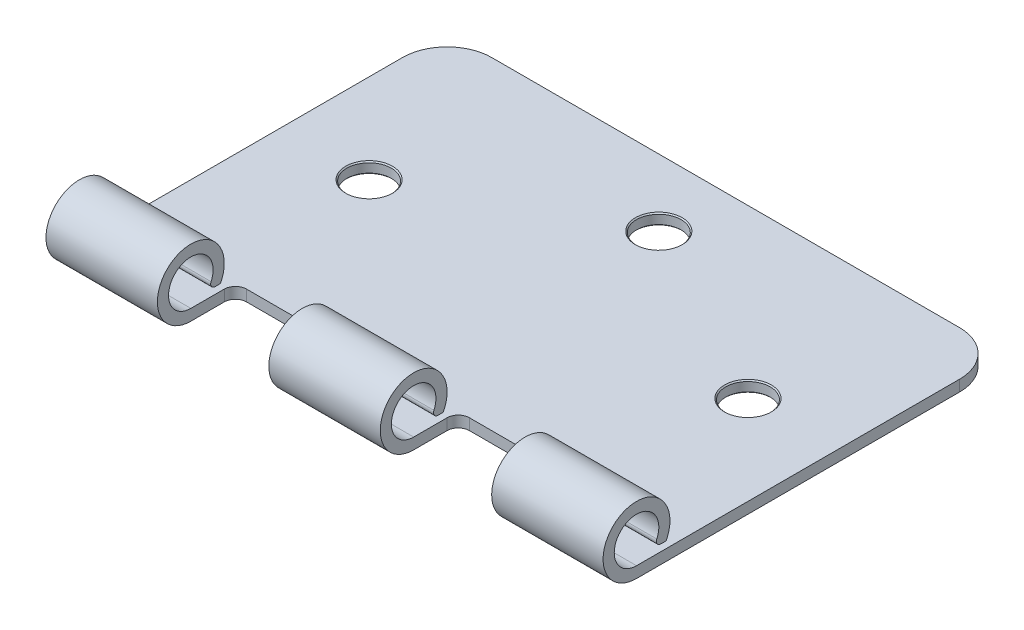
from build123d import *

# Parameters (mm, degrees)
SKETCH1_R           = 10
BOSS_EXTRUDE1_DEPTH = 5
BOSS_EXTRUDE2_DEPTH = 125
SKETCH3_W           = 50
SKETCH3_H           = 35
CUT_EXTRUDE1_DEPTH  = 30
CHAMFER1_SIZE       = 0.5
FILLET2_R           = 5
WRAP1_OUTLINE_W     = 1.13974359
WRAP1_OUTLINE_H     = 12.7
WRAP1_DEPTH         = 5


# Read off the part's stored shape, not the designer's step: Wrap1
with BuildPart() as part:
    # Sketch1 → Boss-Extrude1 (new body)
    with BuildSketch(Plane(origin=(0, 0, 0), x_dir=(1, 0, 0), z_dir=(0, 1, 0))):
        with BuildLine():
            Line((-105, 150), (105, 150))
            ThreePointArc((105, 150), (119.142135624, 144.142135624), (125, 130))
            Line((125, 130), (125, 0))
            Line((125, 0), (-125, 0))
            Line((-125, 0), (-125, 130))
            ThreePointArc((-125, 130), (-119.142135624, 144.142135624), (-105, 150))
        make_face()
        with Locations(Location((-85, 75, 0), (0, 0, 270))):
            Circle(SKETCH1_R, mode=Mode.SUBTRACT)
        with Locations(Location((85, 75, 0), (0, 0, 270))):
            Circle(SKETCH1_R, mode=Mode.SUBTRACT)
        with Locations(Location((0, 120, 0), (0, 0, 270))):
            Circle(SKETCH1_R, mode=Mode.SUBTRACT)
    extrude(amount=BOSS_EXTRUDE1_DEPTH)

    # Sketch2 → Boss-Extrude2 (add, symmetric)
    with BuildSketch(Plane(origin=(0, 0, 0), x_dir=(0, 0, -1), z_dir=(1, 0, 0))):
        with BuildLine():
            Line((0, 0), (-15, 0))
            ThreePointArc((-15, 0), (-22.745966692, 27.845232579), (-1.733500839, 8))
            Line((-1.733500839, 8), (-4.091287885, 8))
            ThreePointArc((-4.091287885, 8), (-5.774538708, 8.91987655), (-5.909406571, 10.833333333))
            ThreePointArc((-5.909406571, 10.833333333), (-20.400617249, 23.416254115), (-15, 5))
            Line((-15, 5), (0, 5))
            Line((0, 5), (0, 0))
        make_face()
    extrude(amount=BOSS_EXTRUDE2_DEPTH, both=True)

    # Sketch3 → Cut-Extrude1 (cut, symmetric)
    with BuildSketch(Plane(origin=(0, 0, 0), x_dir=(1, 0, 0), z_dir=(0, 1, 0))):
        with Locations((-50, -12.5)):
            Rectangle(SKETCH3_W, SKETCH3_H)
        with Locations((50, -12.5)):
            Rectangle(SKETCH3_W, SKETCH3_H)
    extrude(amount=CUT_EXTRUDE1_DEPTH, both=True, mode=Mode.SUBTRACT)

    # Chamfer1
    chamfer1_edges = [part.edges().sort_by_distance(p)[0] for p in [
        (-85, 0, -85),
        (-85, 5, -85),
        (85, 0, -85),
        (85, 5, -85),
        (0, 0, -130),
        (0, 5, -130),
    ]]
    chamfer(chamfer1_edges, length=CHAMFER1_SIZE)

    # Fillet2
    fillet2_edges = [part.edges().sort_by_distance(p)[0] for p in [
        (-25, 2.5, -5),
        (-75, 2.5, -5),
        (75, 2.5, -5),
        (25, 2.5, -5),
    ]]
    fillet(fillet2_edges, radius=FILLET2_R)

    # Wrap1 outline → Wrap1 (add)
    # profile 1 of 17: a face of its own
    with BuildSketch(Plane.XZ):
        with BuildLine():
            add(Edge.make_bspline(
                [(-60.70987489, -35.845821008), (-60.610023001, -36.012968919), (-60.418710634, -36.333217866), (-60.099572845, -36.765954184), (-59.768890568, -37.13375401), (-59.424214986, -37.4344777), (-59.067649974, -37.671237947), (-58.696867836, -37.838886045), (-58.313118066, -37.94344687), (-58.051955914, -37.956147184), (-57.921573608, -37.962487674)],
                knots=[0, 0, 0, 0, 0.159004299, 0.3046461, 0.438546905, 0.562322299, 0.677432543, 0.786897393, 0.893610889, 1, 1, 1, 1], degree=3))
            Line((-60.70987489, -35.845821008), (-61.783472647, -36.489470848))
            add(Edge.make_bspline(
                [(-57.921573608, -39.265051777), (-58.017496139, -39.263196918), (-58.208133154, -39.25951056), (-58.490107559, -39.226921343), (-58.766385497, -39.18081271), (-59.033500178, -39.107609656), (-59.294893072, -39.018793196), (-59.549427323, -38.909434104), (-59.797226289, -38.778380258), (-60.039678662, -38.628538312), (-60.276167809, -38.454157353), (-60.504475593, -38.251053523), (-60.732092923, -38.024828405), (-60.952301476, -37.769338646), (-61.169555456, -37.488711889), (-61.3795714, -37.180322566), (-61.586696489, -36.845850454), (-61.716655473, -36.610482857), (-61.783472647, -36.489470848)],
                knots=[0, 0, 0, 0, 0.057208269, 0.11369606, 0.169177916, 0.224159217, 0.278719878, 0.333794217, 0.389241459, 0.445822073, 0.503704281, 0.564293892, 0.627975416, 0.69503826, 0.765372726, 0.839611443, 0.91753775, 1, 1, 1, 1], degree=3))
            add(Edge.make_bspline(
                [(-54.293729057, -35.828012514), (-54.29611353, -35.941871153), (-54.30083617, -36.167377374), (-54.355122914, -36.498502938), (-54.434659985, -36.82010638), (-54.554537948, -37.128212416), (-54.700853408, -37.428457698), (-54.886513793, -37.712966365), (-55.101715964, -37.988035297), (-55.348581339, -38.24632968), (-55.618713613, -38.48344302), (-55.90422302, -38.694368471), (-56.205576867, -38.870239245), (-56.521140359, -39.0137523), (-56.850985981, -39.125996778), (-57.195002797, -39.207323475), (-57.55375788, -39.257237054), (-57.797599628, -39.262417789), (-57.921573608, -39.265051777)],
                knots=[0, 0, 0, 0, 0.061484255, 0.121774528, 0.18091956, 0.240256115, 0.300114444, 0.361145948, 0.423500582, 0.488669361, 0.553954105, 0.617581261, 0.680238427, 0.742187389, 0.804663212, 0.868258989, 0.933020257, 1, 1, 1, 1], degree=3))
            add(Edge.make_bspline(
                [(-57.28555598, -31.729514918), (-57.147721381, -31.829813566), (-56.880823782, -32.024027995), (-56.501066277, -32.315822034), (-56.156737317, -32.60120108), (-55.846627978, -32.878342683), (-55.567674624, -33.145144621), (-55.322972038, -33.404816732), (-55.110026855, -33.655498667), (-54.880776548, -33.976890585), (-54.646523889, -34.371610519), (-54.445350419, -34.855220128), (-54.318501558, -35.340709633), (-54.301913488, -35.667015583), (-54.293729057, -35.828012514)],
                knots=[0, 0, 0, 0, 0.09697231, 0.187773439, 0.272396139, 0.351320997, 0.424334774, 0.491908784, 0.55423322, 0.611267658, 0.716347845, 0.814540086, 0.908495456, 1, 1, 1, 1], degree=3))
            add(Edge.make_bspline(
                [(-58.992627294, -30.465111873), (-58.964827457, -30.48992051), (-58.898781408, -30.548860151), (-58.778037335, -30.645352141), (-58.618587752, -30.764379343), (-58.424596337, -30.91165332), (-58.192486196, -31.082491769), (-57.922231806, -31.274710304), (-57.616845673, -31.49454897), (-57.400140435, -31.648246331), (-57.28555598, -31.729514918)],
                knots=[0, 0, 0, 0, 0.052594282, 0.124951974, 0.218093899, 0.333502411, 0.468789179, 0.624937586, 0.801683048, 1, 1, 1, 1], degree=3))
            add(Edge.make_bspline(
                [(-59.829626493, -28.824186392), (-59.828200005, -28.892227472), (-59.825344696, -29.028420891), (-59.785521859, -29.229630336), (-59.734361437, -29.430331482), (-59.653289601, -29.629621997), (-59.541365214, -29.830987243), (-59.39438929, -30.03789469), (-59.209283843, -30.252168033), (-59.067490113, -30.391531932), (-58.992627294, -30.465111873)],
                knots=[0, 0, 0, 0, 0.107285214, 0.214745861, 0.32293856, 0.434116163, 0.553412311, 0.686072985, 0.834255992, 1, 1, 1, 1], degree=3))
            add(Edge.make_bspline(
                [(-57.967366878, -27.216333828), (-58.098563402, -27.220730568), (-58.35156354, -27.229209267), (-58.710756682, -27.321810356), (-59.034040353, -27.467613106), (-59.311816803, -27.671956027), (-59.543090977, -27.914057915), (-59.710387928, -28.192655475), (-59.811081382, -28.500294478), (-59.823368739, -28.714894203), (-59.829626493, -28.824186392)],
                knots=[0, 0, 0, 0, 0.143073084, 0.275902964, 0.402370856, 0.528413645, 0.650356379, 0.765895086, 0.880774131, 1, 1, 1, 1], degree=3))
            add(Edge.make_bspline(
                [(-55.486898128, -28.844538956), (-55.549113368, -28.764388566), (-55.668925375, -28.610037652), (-55.850823799, -28.393878879), (-56.022268893, -28.196424796), (-56.191180344, -28.024919903), (-56.348637235, -27.869972162), (-56.501461931, -27.737312473), (-56.647455149, -27.625641026), (-56.831485081, -27.506465823), (-57.062689374, -27.388332224), (-57.352918977, -27.288368427), (-57.656217746, -27.228297202), (-57.86279098, -27.220354667), (-57.967366878, -27.216333828)],
                knots=[0, 0, 0, 0, 0.098469431, 0.189629101, 0.274184089, 0.352183161, 0.423198873, 0.488550946, 0.548473346, 0.601440164, 0.701198082, 0.799591802, 0.898545098, 1, 1, 1, 1], degree=3))
            Line((-55.486898128, -28.844538956), (-54.45654957, -28.063509309))
            add(Edge.make_bspline(
                [(-57.840163352, -25.913769726), (-57.690506188, -25.918931556), (-57.392885855, -25.929196788), (-56.955101558, -26.018450688), (-56.533604101, -26.166135982), (-56.194538541, -26.333734827), (-55.929171092, -26.501125964), (-55.726795747, -26.653597898), (-55.52171814, -26.829130435), (-55.312284056, -27.028191128), (-55.102042234, -27.252606482), (-54.887871422, -27.500839553), (-54.669270789, -27.771373341), (-54.528642383, -27.964502244), (-54.45654957, -28.063509309)],
                knots=[0, 0, 0, 0, 0.107232799, 0.213251813, 0.318830447, 0.426793531, 0.483645951, 0.543603822, 0.60830765, 0.67712676, 0.750685636, 0.828713418, 0.912190348, 1, 1, 1, 1], degree=3))
            add(Edge.make_bspline(
                [(-60.969370083, -28.877611873), (-60.964634039, -28.743246691), (-60.95526318, -28.477388288), (-60.876013303, -28.089019275), (-60.750925946, -27.718228561), (-60.575684496, -27.368687065), (-60.349779244, -27.04949622), (-60.08835528, -26.756984424), (-59.776982173, -26.511081283), (-59.435342654, -26.2962261), (-59.061395247, -26.128056599), (-58.66954254, -26.001198186), (-58.259161736, -25.929318879), (-57.98120179, -25.919003704), (-57.840163352, -25.913769726)],
                knots=[0, 0, 0, 0, 0.083785371, 0.165779888, 0.246280008, 0.327460928, 0.408796954, 0.489715241, 0.571376032, 0.655523321, 0.741019483, 0.826546761, 0.911988852, 1, 1, 1, 1], degree=3))
            add(Edge.make_bspline(
                [(-60.25957441, -30.811105463), (-60.315717645, -30.736353129), (-60.426130853, -30.589342633), (-60.571876073, -30.359563863), (-60.695752463, -30.124348014), (-60.792861497, -29.88306302), (-60.874635777, -29.639096278), (-60.929637411, -29.389264615), (-60.964077623, -29.134689057), (-60.967604545, -28.963371497), (-60.969370083, -28.877611873)],
                knots=[0, 0, 0, 0, 0.133506769, 0.262558979, 0.388264447, 0.512667355, 0.63372227, 0.75539386, 0.877552945, 1, 1, 1, 1], degree=3))
            add(Edge.make_bspline(
                [(-58.17852473, -32.538529341), (-58.312143231, -32.443357037), (-58.567611629, -32.26139484), (-58.924875627, -31.99134101), (-59.24435125, -31.744438969), (-59.524618539, -31.51836441), (-59.765554219, -31.313086673), (-59.969056882, -31.130577008), (-60.129942503, -30.965899516), (-60.219407039, -30.859069505), (-60.25957441, -30.811105463)],
                knots=[0, 0, 0, 0, 0.181535301, 0.347081672, 0.495567816, 0.628357302, 0.74551967, 0.845830751, 0.930781807, 1, 1, 1, 1], degree=3))
            add(Edge.make_bspline(
                [(-55.888861269, -34.563609469), (-55.945723212, -34.490868138), (-56.065097748, -34.338156812), (-56.270320722, -34.1108441), (-56.511134908, -33.876371551), (-56.779299236, -33.62578583), (-57.084582159, -33.37074154), (-57.417421997, -33.099076645), (-57.786316571, -32.821122351), (-58.045031887, -32.634713328), (-58.17852473, -32.538529341)],
                knots=[0, 0, 0, 0, 0.090279215, 0.189529918, 0.299197872, 0.418925887, 0.548376285, 0.68813637, 0.839083502, 1, 1, 1, 1], degree=3))
            add(Edge.make_bspline(
                [(-55.433472647, -35.810204021), (-55.438822289, -35.704464366), (-55.449697328, -35.4895111), (-55.541614413, -35.172375216), (-55.686210252, -34.858530748), (-55.81960613, -34.664397584), (-55.888861269, -34.563609469)],
                knots=[0, 0, 0, 0, 0.234723374, 0.477158319, 0.728556284, 1, 1, 1, 1], degree=3))
            add(Edge.make_bspline(
                [(-57.921573608, -37.962487674), (-57.810224143, -37.959386434), (-57.589473567, -37.953238218), (-57.264490571, -37.894162165), (-56.948870888, -37.803403869), (-56.649119546, -37.67342506), (-56.369372601, -37.516168269), (-56.124056878, -37.326226425), (-55.911980982, -37.113569621), (-55.738502195, -36.876323989), (-55.605406067, -36.621173192), (-55.503109133, -36.359277597), (-55.446339866, -36.086523078), (-55.437788217, -35.902879399), (-55.433472647, -35.810204021)],
                knots=[0, 0, 0, 0, 0.091263605, 0.180930311, 0.27008822, 0.360156133, 0.448342532, 0.532665842, 0.613833704, 0.693981527, 0.772715977, 0.849335172, 0.923967327, 1, 1, 1, 1], degree=3))
        make_face()
    # profile 2 of 17: a face of its own
    with BuildSketch(Plane.XZ):
        with BuildLine():
            add(Edge.make_bspline(
                [(-37.075459826, -26.239410751), (-36.852415212, -26.241016648), (-36.421494178, -26.244119233), (-35.798786154, -26.263791138), (-35.22262793, -26.298590828), (-34.694914413, -26.349280251), (-34.214196873, -26.411521259), (-33.781821352, -26.489537012), (-33.395552147, -26.581659802), (-33.157991606, -26.660201864), (-33.045652134, -26.697343444)],
                knots=[0, 0, 0, 0, 0.164289216, 0.317405911, 0.458843612, 0.589366542, 0.707831319, 0.815770031, 0.912879903, 1, 1, 1, 1], degree=3))
            Line((-37.075459826, -26.239410751), (-39.639882903, -26.239410751))
            Line((-39.639882903, -26.239410751), (-39.639882903, -38.939410751))
            Line((-39.639882903, -38.939410751), (-35.70420582, -38.939410751))
            add(Edge.make_bspline(
                [(-29.219370083, -32.749687194), (-29.221652336, -32.906663688), (-29.226149755, -33.216002265), (-29.266533273, -33.671899229), (-29.325230205, -34.11427133), (-29.416104866, -34.541012013), (-29.526422558, -34.955860118), (-29.667806764, -35.354394262), (-29.82976985, -35.74027037), (-30.018636552, -36.108270926), (-30.225978149, -36.456916305), (-30.448488474, -36.785576079), (-30.685930198, -37.089560455), (-30.940567494, -37.36978999), (-31.20910978, -37.625842232), (-31.493315208, -37.859856116), (-31.793917135, -38.067252758), (-32.109569186, -38.256181979), (-32.449479712, -38.420992983), (-32.820086998, -38.560439019), (-33.222971558, -38.675996738), (-33.657144487, -38.772411131), (-34.123355964, -38.848891629), (-34.622063068, -38.900150253), (-35.152499577, -38.934813752), (-35.51673291, -38.937848665), (-35.70420582, -38.939410751)],
                knots=[0, 0, 0, 0, 0.046080683, 0.0908068, 0.134295271, 0.177024386, 0.218822734, 0.260244116, 0.301079867, 0.341613894, 0.381583419, 0.420119591, 0.458074619, 0.494738488, 0.531194623, 0.566933698, 0.602712651, 0.638326606, 0.674853249, 0.713467371, 0.754441804, 0.797815361, 0.843989456, 0.89307157, 0.944963346, 1, 1, 1, 1], degree=3))
            add(Edge.make_bspline(
                [(-33.045652134, -26.697343444), (-32.89871408, -26.753334861), (-32.608170039, -26.864047997), (-32.194487052, -27.072895148), (-31.805049306, -27.309525545), (-31.437768409, -27.574251104), (-31.101033982, -27.874567454), (-30.781691042, -28.197717451), (-30.49280333, -28.555452285), (-30.22825037, -28.940352956), (-29.989723835, -29.34788526), (-29.782390319, -29.777272654), (-29.610200115, -30.226334523), (-29.467258978, -30.69382206), (-29.354604689, -31.180763203), (-29.277744537, -31.687724945), (-29.227049802, -32.212703718), (-29.221955102, -32.568936772), (-29.219370083, -32.749687194)],
                knots=[0, 0, 0, 0, 0.061544966, 0.121694296, 0.181154855, 0.239875389, 0.298701942, 0.357647424, 0.417604843, 0.478494041, 0.540407051, 0.602344994, 0.665004328, 0.728559309, 0.793650542, 0.860534268, 0.929235961, 1, 1, 1, 1], degree=3))
        make_face()
        with BuildLine():
            add(Edge.make_bspline(
                [(-37.04238691, -37.636846649), (-36.832915393, -37.635946413), (-36.430024953, -37.634214931), (-35.850694506, -37.619021365), (-35.321360696, -37.594194906), (-34.841948362, -37.559451053), (-34.412728188, -37.513482078), (-34.032803152, -37.462228859), (-33.703418644, -37.398375252), (-33.504103258, -37.340496056), (-33.411998288, -37.313749694)],
                knots=[0, 0, 0, 0, 0.171900665, 0.330627932, 0.475548836, 0.60674619, 0.725023803, 0.829742387, 0.92132282, 1, 1, 1, 1], degree=3))
            Line((-37.04238691, -37.636846649), (-38.500139314, -37.636846649))
            Line((-38.500139314, -37.636846649), (-38.500139314, -27.541974854))
            Line((-38.500139314, -27.541974854), (-37.607170564, -27.541974854))
            add(Edge.make_bspline(
                [(-33.704566397, -27.898144726), (-33.811069128, -27.868693687), (-34.037523156, -27.8060727), (-34.407054925, -27.737763491), (-34.822944182, -27.67751288), (-35.287037383, -27.62650228), (-35.798805506, -27.589899714), (-36.358642145, -27.562426658), (-36.966789282, -27.543896877), (-37.388365904, -27.542631568), (-37.607170564, -27.541974854)],
                knots=[0, 0, 0, 0, 0.084318617, 0.179284514, 0.286582528, 0.405111483, 0.535592873, 0.67819021, 0.83297584, 1, 1, 1, 1], degree=3))
            add(Edge.make_bspline(
                [(-30.359113673, -32.747143123), (-30.360976172, -32.598613066), (-30.36463507, -32.306824454), (-30.410624711, -31.878686789), (-30.477831498, -31.466914142), (-30.575018016, -31.071478976), (-30.698864347, -30.691609813), (-30.853422047, -30.32940759), (-31.030012352, -29.981047066), (-31.240118745, -29.654568653), (-31.470226756, -29.345802228), (-31.725597918, -29.062937249), (-32.002175029, -28.805329359), (-32.296941483, -28.568966711), (-32.618204671, -28.363358515), (-32.958396635, -28.179438272), (-33.322508071, -28.023352038), (-33.575828424, -27.94033445), (-33.704566397, -27.898144726)],
                knots=[0, 0, 0, 0, 0.070151176, 0.137812606, 0.203226247, 0.267174055, 0.330024003, 0.391794272, 0.453084399, 0.514333908, 0.574999993, 0.634865483, 0.694116315, 0.753441622, 0.8131258, 0.874079686, 0.936007013, 1, 1, 1, 1], degree=3))
            add(Edge.make_bspline(
                [(-33.411998288, -37.313749694), (-33.296071374, -37.272922611), (-33.066986458, -37.192243599), (-32.737217949, -37.045077229), (-32.429671104, -36.870753147), (-32.138986155, -36.676979182), (-31.869286577, -36.456920831), (-31.617376212, -36.215363243), (-31.383762247, -35.95107706), (-31.170858329, -35.664390302), (-30.980328197, -35.357087329), (-30.815332594, -35.032189276), (-30.670728465, -34.693255993), (-30.557231857, -34.33508276), (-30.468275309, -33.960871605), (-30.405266298, -33.570596203), (-30.366024298, -33.164329437), (-30.361447044, -32.888006015), (-30.359113673, -32.747143123)],
                knots=[0, 0, 0, 0, 0.0624145, 0.123338231, 0.183124538, 0.241782995, 0.300578883, 0.359680075, 0.418881641, 0.479530664, 0.540850536, 0.602303396, 0.664463212, 0.727805723, 0.792894815, 0.859672328, 0.928464401, 1, 1, 1, 1], degree=3))
        make_face(mode=Mode.SUBTRACT)
    # profile 3 of 17: a face of its own
    with BuildSketch(Plane.XZ):
        with BuildLine():
            add(Edge.make_bspline(
                [(-19.727442999, -26.239410751), (-19.556134854, -26.239599061), (-19.22790084, -26.239959869), (-18.757220495, -26.25089909), (-18.329739469, -26.26551023), (-17.946379516, -26.285764528), (-17.605961102, -26.309700727), (-17.310024616, -26.343272413), (-17.05624394, -26.378325485), (-16.904183395, -26.41396316), (-16.834834826, -26.43021604)],
                knots=[0, 0, 0, 0, 0.176955752, 0.33905508, 0.486318225, 0.618780923, 0.735618828, 0.838742477, 0.926457068, 1, 1, 1, 1], degree=3))
            Line((-19.727442999, -26.239410751), (-22.218088032, -26.239410751))
            Line((-22.218088032, -26.239410751), (-22.218088032, -38.939410751))
            Line((-22.218088032, -38.939410751), (-21.078344442, -38.939410751))
            Line((-21.078344442, -38.939410751), (-21.078344442, -33.07787229))
            Line((-21.078344442, -33.07787229), (-20.170111269, -33.07787229))
            add(Edge.make_bspline(
                [(-16.936597647, -32.869258508), (-17.016162545, -32.886178468), (-17.190533644, -32.923259544), (-17.477708664, -32.964655944), (-17.812064779, -32.999989524), (-18.193145623, -33.026482223), (-18.620609135, -33.049162131), (-19.094686555, -33.067189215), (-19.616308492, -33.077094685), (-19.980149863, -33.077605561), (-20.170111269, -33.07787229)],
                knots=[0, 0, 0, 0, 0.075173117, 0.164746258, 0.268016881, 0.385911876, 0.517789479, 0.663690977, 0.824413221, 1, 1, 1, 1], degree=3))
            add(Edge.make_bspline(
                [(-14.402703416, -29.645921168), (-14.404232586, -29.750343387), (-14.40722451, -29.95465251), (-14.443133888, -30.253548056), (-14.49150344, -30.539183357), (-14.565878459, -30.810925077), (-14.663289901, -31.067159445), (-14.777561064, -31.311802201), (-14.915387017, -31.540691296), (-15.0737554, -31.754657694), (-15.249928328, -31.953902233), (-15.443160418, -32.136981059), (-15.652671565, -32.302822515), (-15.877795931, -32.451798391), (-16.120728239, -32.580454034), (-16.377784054, -32.695687683), (-16.651197696, -32.792465531), (-16.840400532, -32.843374611), (-16.936597647, -32.869258508)],
                knots=[0, 0, 0, 0, 0.070118894, 0.137192353, 0.202016181, 0.264631407, 0.326116547, 0.386010305, 0.445811847, 0.505297697, 0.564633278, 0.624282625, 0.683902032, 0.743952771, 0.805387731, 0.868388031, 0.933084028, 1, 1, 1, 1], degree=3))
            add(Edge.make_bspline(
                [(-16.834834826, -26.43021604), (-16.747046861, -26.454244258), (-16.573539544, -26.501734499), (-16.323527187, -26.596852867), (-16.085660376, -26.709636723), (-15.859123007, -26.838175019), (-15.646698877, -26.987982638), (-15.445218671, -27.152986908), (-15.256460457, -27.336997457), (-15.081485692, -27.537950427), (-14.920795141, -27.752472332), (-14.782438864, -27.983765566), (-14.66658864, -28.227936867), (-14.567226484, -28.484816396), (-14.495712949, -28.756561285), (-14.441839913, -29.041283355), (-14.407645607, -29.338952088), (-14.404370597, -29.542369322), (-14.402703416, -29.645921168)],
                knots=[0, 0, 0, 0, 0.062481339, 0.123490383, 0.183411094, 0.243153221, 0.302126735, 0.361709671, 0.421842292, 0.482931901, 0.544552254, 0.60568072, 0.667679738, 0.729984388, 0.794550921, 0.86034562, 0.928907356, 1, 1, 1, 1], degree=3))
        make_face()
        with BuildLine():
            add(Edge.make_bspline(
                [(-18.854826814, -31.803292963), (-18.746260226, -31.803349074), (-18.536674666, -31.803457394), (-18.23392037, -31.788996726), (-17.953035242, -31.772303365), (-17.694882068, -31.747861585), (-17.459344478, -31.713313023), (-17.24602973, -31.678436145), (-17.056591875, -31.627979544), (-16.834889057, -31.56004155), (-16.587843768, -31.444171773), (-16.319084377, -31.275987886), (-16.091316821, -31.061609316), (-15.894219001, -30.820571186), (-15.737806244, -30.552422916), (-15.623303072, -30.265515631), (-15.556025158, -29.96279172), (-15.547003827, -29.755643331), (-15.542447006, -29.651009309)],
                knots=[0, 0, 0, 0, 0.072538371, 0.140033831, 0.202495681, 0.260575056, 0.313228338, 0.361583194, 0.404878361, 0.444127437, 0.516399693, 0.586506671, 0.655085374, 0.724383783, 0.793973529, 0.861637682, 0.930110942, 1, 1, 1, 1], degree=3))
            Line((-18.854826814, -31.803292963), (-21.078344442, -31.775308187))
            Line((-21.078344442, -31.775308187), (-21.078344442, -27.541974854))
            Line((-21.078344442, -27.541974854), (-18.755608064, -27.541974854))
            add(Edge.make_bspline(
                [(-15.542447006, -29.651009309), (-15.547028609, -29.548906703), (-15.556136269, -29.345939359), (-15.623830401, -29.048473571), (-15.737583625, -28.764589729), (-15.895268982, -28.499801677), (-16.08664394, -28.259630874), (-16.309072985, -28.050998441), (-16.562032533, -27.883279691), (-16.797338971, -27.775027498), (-17.006348989, -27.70893207), (-17.187893529, -27.662686506), (-17.392873977, -27.625763592), (-17.621357062, -27.595865967), (-17.87157186, -27.570271979), (-18.145668031, -27.552905719), (-18.442607251, -27.542740435), (-18.648748465, -27.542236226), (-18.755608064, -27.541974854)],
                knots=[0, 0, 0, 0, 0.070043755, 0.139238317, 0.208197455, 0.279173374, 0.349986812, 0.418353846, 0.487609584, 0.557411073, 0.595330157, 0.637964052, 0.685912778, 0.738185165, 0.796102647, 0.858516544, 0.926657726, 1, 1, 1, 1], degree=3))
        make_face(mode=Mode.SUBTRACT)
    # profile 4 of 17: a face of its own
    with BuildSketch(Plane.XZ):
        with BuildLine():
            add(Edge.make_bspline(
                [(50.448198026, -26.239410751), (50.619506171, -26.239599061), (50.947740185, -26.239959869), (51.41842053, -26.25089909), (51.845901556, -26.26551023), (52.22926151, -26.285764528), (52.569679923, -26.309700727), (52.86561641, -26.343272413), (53.119397086, -26.378325485), (53.271457631, -26.41396316), (53.340806199, -26.43021604)],
                knots=[0, 0, 0, 0, 0.176955752, 0.33905508, 0.486318225, 0.618780923, 0.735618828, 0.838742477, 0.926457068, 1, 1, 1, 1], degree=3))
            Line((50.448198026, -26.239410751), (47.957552994, -26.239410751))
            Line((47.957552994, -26.239410751), (47.957552994, -38.939410751))
            Line((47.957552994, -38.939410751), (49.097296584, -38.939410751))
            Line((49.097296584, -38.939410751), (49.097296584, -33.07787229))
            Line((49.097296584, -33.07787229), (50.005529757, -33.07787229))
            add(Edge.make_bspline(
                [(53.239043379, -32.869258508), (53.159478481, -32.886178468), (52.985107382, -32.923259544), (52.697932361, -32.964655944), (52.363576247, -32.999989524), (51.982495402, -33.026482223), (51.55503189, -33.049162131), (51.080954471, -33.067189215), (50.559332534, -33.077094685), (50.195491162, -33.077605561), (50.005529757, -33.07787229)],
                knots=[0, 0, 0, 0, 0.075173117, 0.164746258, 0.268016881, 0.385911876, 0.517789479, 0.663690977, 0.824413221, 1, 1, 1, 1], degree=3))
            add(Edge.make_bspline(
                [(55.77293761, -29.645921168), (55.77140844, -29.750343387), (55.768416516, -29.95465251), (55.732507138, -30.253548056), (55.684137585, -30.539183357), (55.609762567, -30.810925077), (55.512351124, -31.067159445), (55.398079961, -31.311802201), (55.260254008, -31.540691296), (55.101885626, -31.754657694), (54.925712698, -31.953902233), (54.732480608, -32.136981059), (54.522969461, -32.302822515), (54.297845095, -32.451798391), (54.054912786, -32.580454034), (53.797856972, -32.695687683), (53.52444333, -32.792465531), (53.335240493, -32.843374611), (53.239043379, -32.869258508)],
                knots=[0, 0, 0, 0, 0.070118894, 0.137192353, 0.202016181, 0.264631407, 0.326116547, 0.386010305, 0.445811847, 0.505297697, 0.564633278, 0.624282625, 0.683902032, 0.743952771, 0.805387731, 0.868388031, 0.933084028, 1, 1, 1, 1], degree=3))
            add(Edge.make_bspline(
                [(53.340806199, -26.43021604), (53.428594165, -26.454244258), (53.602101482, -26.501734499), (53.852113838, -26.596852867), (54.089980649, -26.709636723), (54.316518018, -26.838175019), (54.528942148, -26.987982638), (54.730422354, -27.152986908), (54.919180568, -27.336997457), (55.094155333, -27.537950427), (55.254845884, -27.752472332), (55.393202162, -27.983765566), (55.509052386, -28.227936867), (55.608414542, -28.484816396), (55.679928077, -28.756561285), (55.733801113, -29.041283355), (55.767995419, -29.338952088), (55.771270429, -29.542369322), (55.77293761, -29.645921168)],
                knots=[0, 0, 0, 0, 0.062481339, 0.123490383, 0.183411094, 0.243153221, 0.302126735, 0.361709671, 0.421842292, 0.482931901, 0.544552254, 0.60568072, 0.667679738, 0.729984388, 0.794550921, 0.86034562, 0.928907356, 1, 1, 1, 1], degree=3))
        make_face()
        with BuildLine():
            add(Edge.make_bspline(
                [(51.320814212, -31.803292963), (51.4293808, -31.803349074), (51.63896636, -31.803457394), (51.941720656, -31.788996726), (52.222605784, -31.772303365), (52.480758957, -31.747861585), (52.716296548, -31.713313023), (52.929611296, -31.678436145), (53.119049151, -31.627979544), (53.340751969, -31.56004155), (53.587797258, -31.444171773), (53.856556648, -31.275987886), (54.084324205, -31.061609316), (54.281422024, -30.820571186), (54.437834781, -30.552422916), (54.552337953, -30.265515631), (54.619615867, -29.96279172), (54.628637199, -29.755643331), (54.63319402, -29.651009309)],
                knots=[0, 0, 0, 0, 0.072538371, 0.140033831, 0.202495681, 0.260575056, 0.313228338, 0.361583194, 0.404878361, 0.444127437, 0.516399693, 0.586506671, 0.655085374, 0.724383783, 0.793973529, 0.861637682, 0.930110942, 1, 1, 1, 1], degree=3))
            Line((51.320814212, -31.803292963), (49.097296584, -31.775308187))
            Line((49.097296584, -31.775308187), (49.097296584, -27.541974854))
            Line((49.097296584, -27.541974854), (51.420032962, -27.541974854))
            add(Edge.make_bspline(
                [(54.63319402, -29.651009309), (54.628612417, -29.548906703), (54.619504757, -29.345939359), (54.551810625, -29.048473571), (54.4380574, -28.764589729), (54.280372043, -28.499801677), (54.088997086, -28.259630874), (53.866568041, -28.050998441), (53.613608493, -27.883279691), (53.378302054, -27.775027498), (53.169292036, -27.70893207), (52.987747496, -27.662686506), (52.782767049, -27.625763592), (52.554283963, -27.595865967), (52.304069166, -27.570271979), (52.029972995, -27.552905719), (51.733033775, -27.542740435), (51.526892561, -27.542236226), (51.420032962, -27.541974854)],
                knots=[0, 0, 0, 0, 0.070043755, 0.139238317, 0.208197455, 0.279173374, 0.349986812, 0.418353846, 0.487609584, 0.557411073, 0.595330157, 0.637964052, 0.685912778, 0.738185165, 0.796102647, 0.858516544, 0.926657726, 1, 1, 1, 1], degree=3))
        make_face(mode=Mode.SUBTRACT)
    # profile 5 of 17: a face of its own
    with BuildSketch(Plane.XZ):
        with BuildLine():
            add(Edge.make_bspline(
                [(81.434976872, -26.239410751), (81.604580396, -26.239975306), (81.930237948, -26.241059314), (82.396775244, -26.247103654), (82.82069071, -26.264427745), (83.201762698, -26.279336033), (83.539984218, -26.306521077), (83.836392387, -26.332503997), (84.089622032, -26.366516995), (84.242914121, -26.398105244), (84.312320622, -26.412407546)],
                knots=[0, 0, 0, 0, 0.176257755, 0.338434414, 0.484822051, 0.617157578, 0.734698361, 0.837385184, 0.926372421, 1, 1, 1, 1], degree=3))
            Line((81.434976872, -26.239410751), (78.89345043, -26.239410751))
            Line((78.89345043, -26.239410751), (78.89345043, -38.939410751))
            Line((78.89345043, -38.939410751), (80.03319402, -38.939410751))
            Line((80.03319402, -38.939410751), (80.03319402, -33.07787229))
            Line((80.03319402, -33.07787229), (80.959235686, -33.07787229))
            Line((80.959235686, -33.07787229), (85.625061007, -38.939410751))
            Line((85.625061007, -38.939410751), (87.034476071, -38.939410751))
            Line((87.034476071, -38.939410751), (82.368650751, -33.07787229))
            add(Edge.make_bspline(
                [(86.871655558, -29.635744886), (86.866325194, -29.804963694), (86.855924272, -30.135153418), (86.758950324, -30.614345759), (86.600104095, -31.061346986), (86.381216732, -31.475594272), (86.102471778, -31.8490129), (85.767464679, -32.177001123), (85.376008545, -32.451465949), (85.011593599, -32.641794697), (84.689687789, -32.763688966), (84.424681197, -32.849455182), (84.135603878, -32.915720028), (83.82522555, -32.975083934), (83.492254571, -33.01990294), (83.137489, -33.052729154), (82.760675821, -33.073245274), (82.501816912, -33.076300549), (82.368650751, -33.07787229)],
                knots=[0, 0, 0, 0, 0.078780236, 0.153720644, 0.22671353, 0.299191166, 0.371189997, 0.443006414, 0.516689173, 0.593217217, 0.633872918, 0.676989142, 0.722899506, 0.771958611, 0.824211323, 0.879378651, 0.937948119, 1, 1, 1, 1], degree=3))
            add(Edge.make_bspline(
                [(84.312320622, -26.412407546), (84.405236087, -26.435364666), (84.589084877, -26.480789169), (84.853789403, -26.57679972), (85.106027093, -26.687905215), (85.344750169, -26.818402143), (85.568762897, -26.969259201), (85.780375054, -27.137872102), (85.980546878, -27.323318249), (86.161183079, -27.530273245), (86.331504781, -27.747394295), (86.47515494, -27.982176498), (86.598985309, -28.227691184), (86.697575471, -28.486435242), (86.77696126, -28.755899386), (86.832936472, -29.038524448), (86.866505067, -29.333022844), (86.869922657, -29.53389297), (86.871655558, -29.635744886)],
                knots=[0, 0, 0, 0, 0.064216843, 0.127063766, 0.188744538, 0.249132103, 0.309452533, 0.369826676, 0.430650142, 0.492351932, 0.554072106, 0.615689784, 0.676797703, 0.738439048, 0.80131691, 0.865184512, 0.931641324, 1, 1, 1, 1], degree=3))
        make_face()
        with BuildLine():
            add(Edge.make_bspline(
                [(82.358474468, -31.793116681), (82.467041467, -31.793164711), (82.677475231, -31.793257807), (82.981914786, -31.778766105), (83.265379192, -31.76228035), (83.526784207, -31.737064153), (83.766246609, -31.704566407), (83.983646708, -31.663915579), (84.179339382, -31.616555237), (84.407571221, -31.543252195), (84.662429492, -31.427116072), (84.939403647, -31.258149833), (85.175269272, -31.045627601), (85.374542658, -30.802609632), (85.534669453, -30.535415243), (85.647561764, -30.247247275), (85.719198626, -29.945380619), (85.72764792, -29.737905771), (85.731911968, -29.633200815)],
                knots=[0, 0, 0, 0, 0.07166815, 0.138913286, 0.20118457, 0.259124428, 0.312255041, 0.36068151, 0.405086143, 0.445101659, 0.51877778, 0.589461579, 0.658462242, 0.727283218, 0.796322487, 0.863174893, 0.930949381, 1, 1, 1, 1], degree=3))
            Line((82.358474468, -31.793116681), (80.03319402, -31.775308187))
            Line((80.03319402, -31.775308187), (80.03319402, -27.541974854))
            Line((80.03319402, -27.541974854), (82.41444402, -27.541974854))
            add(Edge.make_bspline(
                [(85.731911968, -29.633200815), (85.727549986, -29.531068962), (85.718906129, -29.328680896), (85.648334883, -29.032386593), (85.528993414, -28.75274366), (85.368167008, -28.490889671), (85.172227217, -28.25319743), (84.942474011, -28.049826332), (84.685189445, -27.882006845), (84.444719669, -27.774766665), (84.229784098, -27.709017483), (84.043167903, -27.662748974), (83.832306255, -27.625576187), (83.596175305, -27.595792652), (83.335783102, -27.570193283), (83.049813025, -27.552951114), (82.740162422, -27.542740808), (82.525543558, -27.542236114), (82.41444402, -27.541974854)],
                knots=[0, 0, 0, 0, 0.068814296, 0.136364825, 0.204019354, 0.273063739, 0.34291332, 0.410965444, 0.479168767, 0.549308007, 0.587651576, 0.630646669, 0.678878786, 0.731934299, 0.791111423, 0.85528319, 0.925085939, 1, 1, 1, 1], degree=3))
        make_face(mode=Mode.SUBTRACT)
    # profile 6 of 17: a face of its own
    with BuildSketch(Plane.XZ):
        Polygon((-89.648676974, -34.868897931), (-87.771152935, -38.939410751), (-86.532190596, -38.939410751), (-92.393729057, -26.239410751), (-92.55654957, -26.239410751), (-98.580908544, -38.939410751), (-97.336858064, -38.939410751), (-95.405908544, -34.868897931), align=None)
        Polygon((-92.487859666, -28.71479136), (-90.249077615, -33.566333828), (-94.78769941, -33.566333828), align=None, mode=Mode.SUBTRACT)
    # profile 7 of 17: a face of its own
    with BuildSketch(Plane.XZ):
        Polygon((-83.112959826, -32.810744886), (-77.223436589, -38.939410751), (-75.704626493, -38.939410751), (-82.433692999, -31.9381287), (-76.193088032, -26.239410751), (-77.818749089, -26.239410751), (-83.112959826, -31.075688796), (-83.112959826, -26.239410751), (-84.252703416, -26.239410751), (-84.252703416, -38.939410751), (-83.112959826, -38.939410751), align=None)
    # profile 8 of 17: a face of its own
    with BuildSketch(Plane.XZ):
        Polygon((-65.876882102, -34.868897931), (-63.999358064, -38.939410751), (-62.760395724, -38.939410751), (-68.621934185, -26.239410751), (-68.784754698, -26.239410751), (-74.809113673, -38.939410751), (-73.565063192, -38.939410751), (-71.634113673, -34.868897931), align=None)
        Polygon((-68.716064794, -28.71479136), (-66.477282743, -33.566333828), (-71.015904538, -33.566333828), align=None, mode=Mode.SUBTRACT)
    # profile 9 of 17: a face of its own
    with BuildSketch(Plane.XZ):
        Polygon((-44.036036749, -32.752231264), (-44.036036749, -38.939410751), (-42.89629316, -38.939410751), (-42.89629316, -26.239410751), (-44.036036749, -26.239410751), (-44.036036749, -31.449667162), (-50.548857262, -31.449667162), (-50.548857262, -26.239410751), (-51.688600852, -26.239410751), (-51.688600852, -38.939410751), (-50.548857262, -38.939410751), (-50.548857262, -32.752231264), align=None)
    # profile 10 of 17: a face of its own
    with BuildSketch(Plane.XZ):
        with Locations((-26.044370083, -32.589410751)):
            Rectangle(WRAP1_OUTLINE_W, WRAP1_OUTLINE_H)
    # profile 11 of 17: a face of its own
    with BuildSketch(Plane.XZ):
        Polygon((4.240245302, -29.801109469), (5.456311007, -38.939410751), (6.601142738, -38.939410751), (4.914423988, -26.239410751), (4.749059404, -26.239410751), (-0.48154957, -36.659923572), (-5.724878897, -26.239410751), (-5.88769941, -26.239410751), (-7.564241878, -38.939410751), (-6.416866076, -38.939410751), (-5.203344442, -29.780756905), (-0.601120884, -38.939410751), (-0.344169762, -38.939410751), align=None)
    # profile 12 of 17: a face of its own
    with BuildSketch(Plane.XZ):
        Polygon((17.161579436, -34.868897931), (19.039103475, -38.939410751), (20.278065815, -38.939410751), (14.416527353, -26.239410751), (14.25370684, -26.239410751), (8.229347866, -38.939410751), (9.473398347, -38.939410751), (11.404347866, -34.868897931), align=None)
        Polygon((14.322396744, -28.71479136), (16.561178795, -33.566333828), (12.022557001, -33.566333828), align=None, mode=Mode.SUBTRACT)
    # profile 13 of 17: a face of its own
    with BuildSketch(Plane.XZ):
        Polygon((30.210117097, -32.752231264), (30.210117097, -38.939410751), (31.349860686, -38.939410751), (31.349860686, -26.239410751), (30.210117097, -26.239410751), (30.210117097, -31.449667162), (23.697296584, -31.449667162), (23.697296584, -26.239410751), (22.557552994, -26.239410751), (22.557552994, -38.939410751), (23.697296584, -38.939410751), (23.697296584, -32.752231264), align=None)
    # profile 14 of 17: a face of its own
    with BuildSketch(Plane.XZ):
        Polygon((42.561579436, -34.868897931), (44.439103475, -38.939410751), (45.678065815, -38.939410751), (39.816527353, -26.239410751), (39.65370684, -26.239410751), (33.629347866, -38.939410751), (34.873398347, -38.939410751), (36.804347866, -34.868897931), align=None)
        Polygon((39.722396744, -28.71479136), (41.961178795, -33.566333828), (37.422557001, -33.566333828), align=None, mode=Mode.SUBTRACT)
    # profile 15 of 17: a face of its own
    with BuildSketch(Plane.XZ):
        Polygon((66.333374308, -34.868897931), (68.210898347, -38.939410751), (69.449860686, -38.939410751), (63.588322225, -26.239410751), (63.425501712, -26.239410751), (57.401142738, -38.939410751), (58.645193218, -38.939410751), (60.576142738, -34.868897931), align=None)
        Polygon((63.494191616, -28.71479136), (65.732973667, -33.566333828), (61.194351872, -33.566333828), align=None, mode=Mode.SUBTRACT)
    # profile 16 of 17: a face of its own
    with BuildSketch(Plane.XZ):
        Polygon((73.031911968, -27.541974854), (73.031911968, -38.939410751), (74.171655558, -38.939410751), (74.171655558, -27.541974854), (76.939604276, -27.541974854), (76.939604276, -26.239410751), (70.263963251, -26.239410751), (70.263963251, -27.541974854), align=None)
    # profile 17 of 17: a face of its own
    with BuildSketch(Plane.XZ):
        Polygon((97.59491277, -34.868897931), (99.472436808, -38.939410751), (100.711399148, -38.939410751), (94.849860686, -26.239410751), (94.687040174, -26.239410751), (88.662681199, -38.939410751), (89.90673168, -38.939410751), (91.837681199, -34.868897931), align=None)
        Polygon((94.755730077, -28.71479136), (96.994512129, -33.566333828), (92.455890334, -33.566333828), align=None, mode=Mode.SUBTRACT)
    extrude(amount=WRAP1_DEPTH)


solid = part.part
